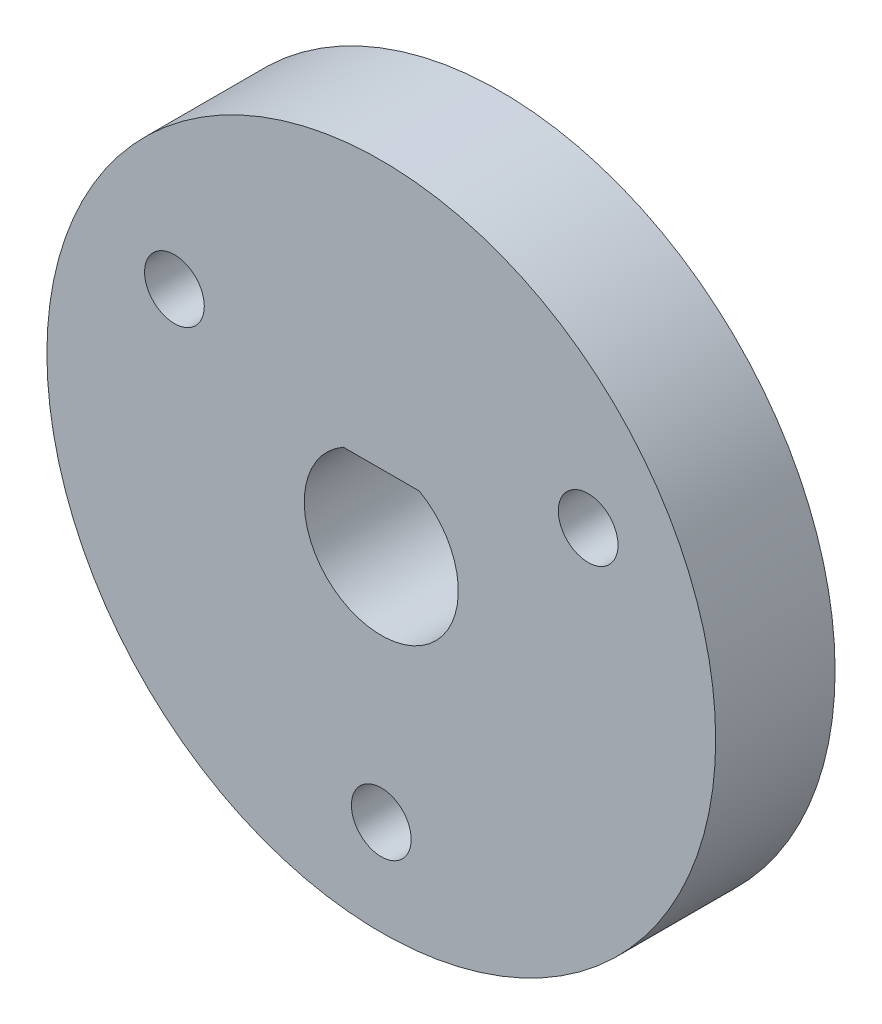
from build123d import *

# Parameters (mm, degrees)
SKETCH1_R              = 14
BOSS_EXTRUDE1_DEPTH    = 2.5
M2_5_CLEARANCE_HOLE2_D = 2.5
CIRPATTERN1_COUNT      = 3


with BuildPart() as part:
    # Sketch1 → Boss-Extrude1 (new, symmetric)
    with BuildSketch(Plane.XY):
        Circle(SKETCH1_R)
        with BuildLine():
            Line((-1.5875, 2.807217261), (1.5875, 2.807217261))
            ThreePointArc((1.5875, 2.807217261), (0, -3.225), (-1.5875, 2.807217261))
        make_face(mode=Mode.SUBTRACT)
    extrude(amount=BOSS_EXTRUDE1_DEPTH, both=True)

    # M2.5 Clearance Hole2 (through all)
    with Locations(Plane.XY.offset(2.5)):
        with Locations((0, -10)):
            m2_5_clearance_hole2 = Hole(M2_5_CLEARANCE_HOLE2_D / 2)

    # CirPattern1: M2.5 Clearance Hole2 ×3 about axis
    cirpattern1_axis = Axis((0, 0, 2.5), (0, 0, -1))
    for i in range(1, CIRPATTERN1_COUNT):
        add(m2_5_clearance_hole2.rotate(cirpattern1_axis, i * 360 / CIRPATTERN1_COUNT), mode=Mode.SUBTRACT)


solid = part.part
